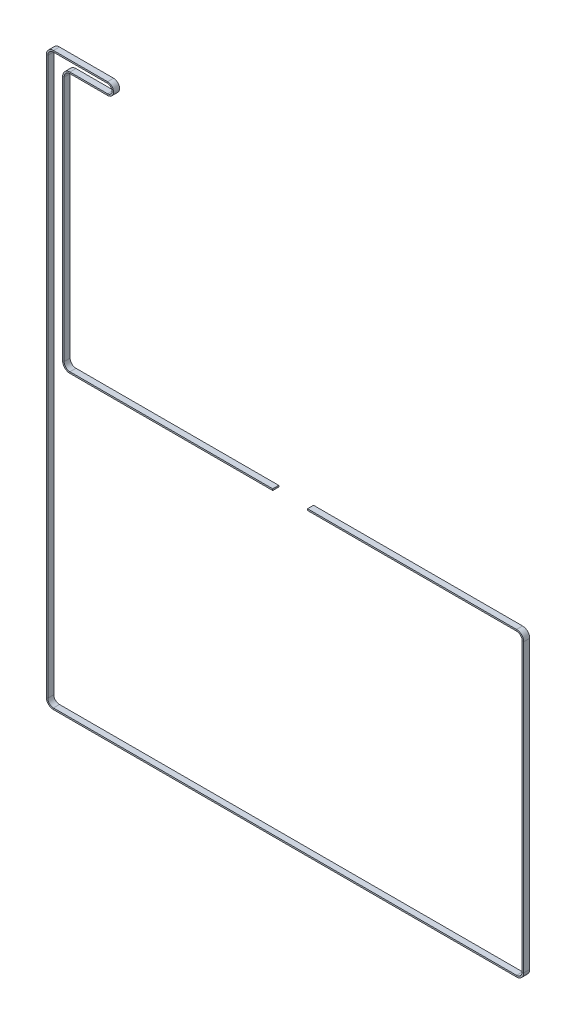
from build123d import *

# Parameters (mm, degrees)
SKETCH2_W = 6
SKETCH2_H = 1.5


with BuildPart() as part:
    # Sweep1: sweep along a path in Sketch1
    with BuildLine(Plane(origin=(0, -21, 4.45), x_dir=(1, 0, 0), z_dir=(0, 0, 1))) as sweep1_path:
        Line((246.978539652, -195.521855757), (455.5, -195.521855757))
        ThreePointArc((455.5, -195.521855757), (460.00780573, -197.389050027), (461.875, -201.896855757))
        Line((461.875, -201.896855757), (461.875, -488))
        ThreePointArc((461.875, -488), (460.00780573, -492.50780573), (455.5, -494.375))
        Line((455.5, -494.375), (-6.5, -494.375))
        ThreePointArc((-6.5, -494.375), (-11.00780573, -492.50780573), (-12.875, -488))
        Line((-12.875, -488), (-12.875, 67.325))
        ThreePointArc((-12.875, 67.325), (-11.00780573, 71.83280573), (-6.5, 73.7))
        Line((-6.5, 73.7), (47.5, 73.7))
        ThreePointArc((47.5, 73.7), (52.7, 68.5), (47.5, 63.3))
        Line((47.5, 63.3), (10, 63.3))
        ThreePointArc((10, 63.3), (5.333095244, 61.366904756), (3.4, 56.7))
        Line((3.4, 56.7), (3.4, -189.071855757))
        ThreePointArc((3.4, -189.071855757), (5.333095244, -193.738760513), (10, -195.671855757))
        Line((10, -195.671855757), (212.278539652, -195.671855757))
    # Sketch2 → Sweep1 (sweep)
    with BuildSketch(Plane(origin=(246.978539652, -216.521855757, 4.45), x_dir=(0, 0, 1), z_dir=(-1, 0, 0))):
        Rectangle(SKETCH2_W, SKETCH2_H)
    sweep(path=sweep1_path.line)


solid = part.part
